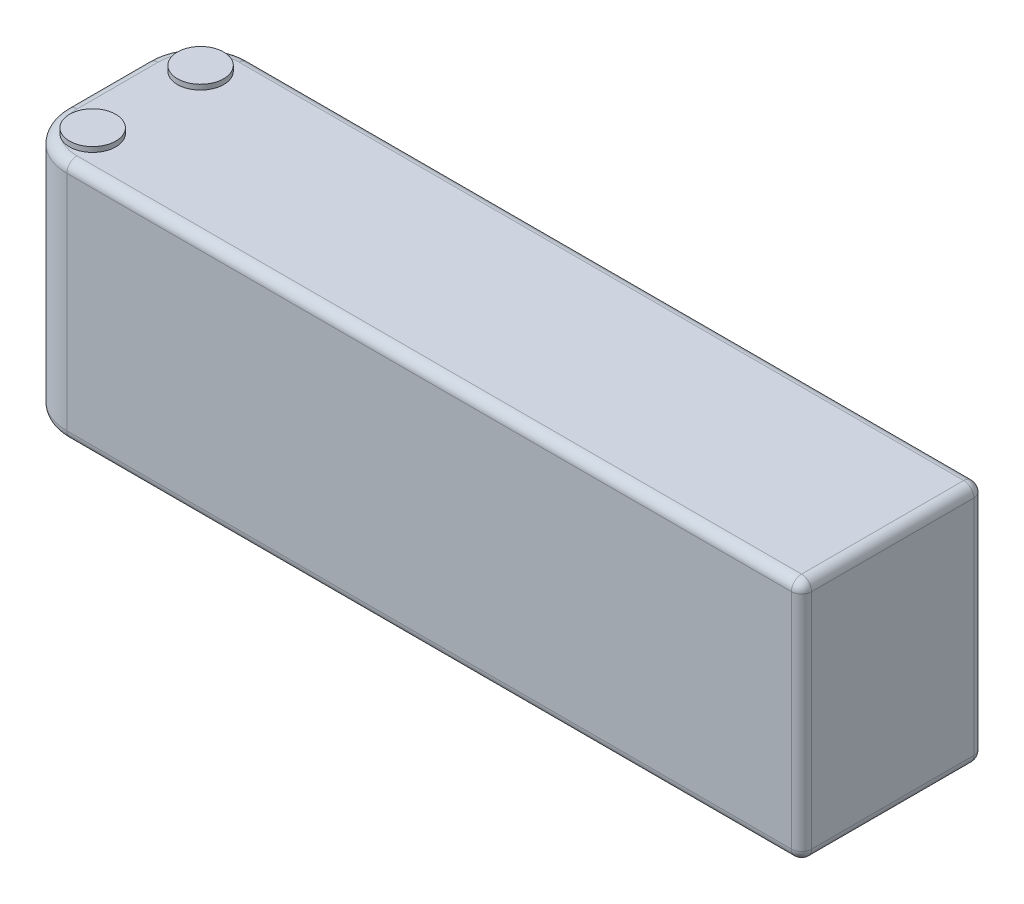
from build123d import *

# Parameters (mm, degrees)
BOSS_EXTRUDE1_DEPTH = 48
FILLET1_R           = 2
SKETCH7_R           = 4.572679887
BOSS_EXTRUDE3_DEPTH = 1


with BuildPart() as part:
    # Sketch3 → Boss-Extrude1 (new body)
    with BuildSketch(Plane(origin=(0, 0, 0), x_dir=(1, 0, 0), z_dir=(0, 1, 0))):
        with BuildLine():
            Line((10, 0), (155, 0))
            Line((155, 0), (155, 36))
            Line((155, 36), (10, 36))
            ThreePointArc((10, 36), (2.928932188, 33.071067812), (0, 26))
            Line((0, 26), (0, 10))
            ThreePointArc((0, 10), (2.928932188, 2.928932188), (10, 0))
        make_face()
    extrude(amount=BOSS_EXTRUDE1_DEPTH)

    # Fillet1
    fillet1_edges = [part.edges().sort_by_distance(p)[0] for p in [
        (82.5, 48, -36),
        (82.5, 0, 0),
        (155, 24, -36),
        (155, 0, -18),
        (82.5, 48, 0),
        (82.5, 0, -36),
        (155, 48, -18),
        (155, 24, 0),
        (2.928932188, 48, -33.071067812),
        (0, 48, -18),
        (2.928932188, 48, -2.928932188),
        (2.928932188, 0, -2.928932188),
        (0, 0, -18),
        (2.928932188, 0, -33.071067812),
    ]]
    fillet(fillet1_edges, radius=FILLET1_R)

    # Sketch7 → Boss-Extrude3 (add)
    with BuildSketch(Plane(origin=(0, 48, 0), x_dir=(1, 0, 0), z_dir=(0, 1, 0))):
        with Locations((7.738139678, 28.650889337)):
            Circle(SKETCH7_R)
        with Locations((7.738139678, 7.349110663)):
            Circle(SKETCH7_R)
    extrude(amount=BOSS_EXTRUDE3_DEPTH)


solid = part.part
